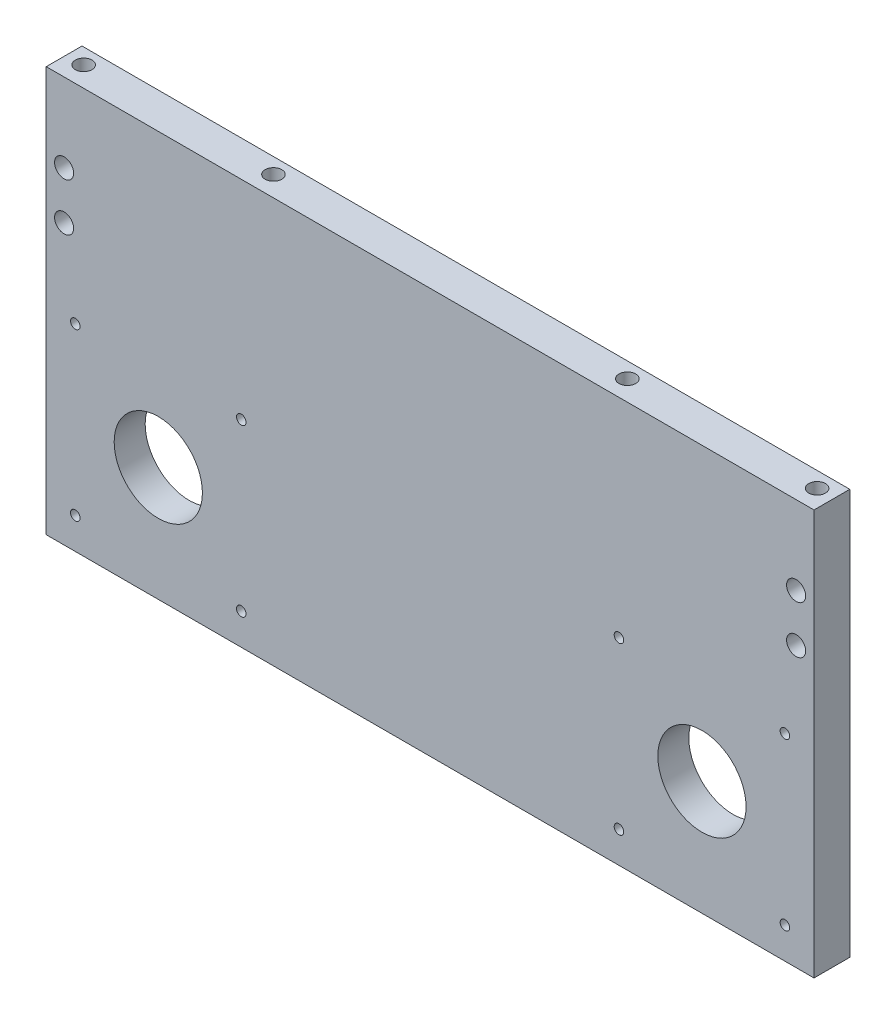
from build123d import *

# Parameters (mm, degrees)
SZKIC1_W                       = 322
SZKIC1_H                       = 170
DODANIE_WYCI_GNI_CIE1_DEPTH    = 15
SZKIC2_R                       = 2
WYTNIJ_WYCI_GNI_CIE2_DEPTH     = 17.75
SZYK_LINIOWY1_COUNT            = 2
SZYK_LINIOWY1_PITCH            = 69.6
SZYK_LINIOWY1_COUNT_DIR2       = 2
SZYK_LINIOWY1_PITCH_DIR2       = 69.6
SZKIC5_R                       = 37.5
WYTNIJ_WYCI_GNI_CIE3_DEPTH     = 2
SZKIC7_R                       = 18.5
WYTNIJ_WYCI_GNI_CIE4_DEPTH     = 17.75
SZYK_LINIOWY2_COUNT            = 2
SZYK_LINIOWY2_PITCH            = 228
SZYK_LINIOWY2_COPY_1_SKETCH_R  = 2
SZYK_LINIOWY2_COPY_1_DEPTH     = 17.75
SZYK_LINIOWY2_COPY_2_SKETCH_R  = 2
SZYK_LINIOWY2_COPY_2_DEPTH     = 17.75
SZYK_LINIOWY2_COPY_3_SKETCH_R  = 2
SZYK_LINIOWY2_COPY_3_DEPTH     = 17.75
SZKIC10_R                      = 4
WYTNIJ_WYCI_GNI_CIE7_DEPTH     = 183.677311125
SZKIC11_R                      = 4
WYTNIJ_WYCI_GNI_CIE8_DEPTH     = 183.677311125
OTW_R_GWINTOWANY_M8X1_01_D     = 7
OTW_R_GWINTOWANY_M8X1_01_DEPTH = 21
OTW_R_GWINTOWANY_M8X1_01_TIP   = 2.103012167


with BuildPart() as part:
    # Szkic1 → Dodanie-wyciągnięcie1 (new body)
    with BuildSketch(Plane.XY):
        Rectangle(SZKIC1_W, SZKIC1_H)
    extrude(amount=DODANIE_WYCI_GNI_CIE1_DEPTH)

    # Szkic2 → Wytnij-wyciągnięcie2 (cut)
    with BuildSketch(Plane.XY.offset(15)):
        with Locations((-148.8, -71.87)):
            Circle(SZKIC2_R)
    wytnij_wyci_gni_cie2 = extrude(amount=-WYTNIJ_WYCI_GNI_CIE2_DEPTH, mode=Mode.SUBTRACT)

    # Szyk liniowy1: Wytnij-wyci_gni_cie2 2 × 2
    with Locations(*[(i * SZYK_LINIOWY1_PITCH, j * SZYK_LINIOWY1_PITCH_DIR2, 0) for i in range(SZYK_LINIOWY1_COUNT) for j in range(SZYK_LINIOWY1_COUNT_DIR2) if (i, j) != (0, 0)]):
        add(wytnij_wyci_gni_cie2, mode=Mode.SUBTRACT)

    # Szkic5 → Wytnij-wyciągnięcie3 (cut)
    with BuildSketch(Plane(origin=(0, 0, 0), x_dir=(-1, 0, 0), z_dir=(0, 0, -1))):
        with Locations((114, -37.07)):
            Circle(SZKIC5_R)
    wytnij_wyci_gni_cie3 = extrude(amount=-WYTNIJ_WYCI_GNI_CIE3_DEPTH, mode=Mode.SUBTRACT)

    # Szkic7 → Wytnij-wyciągnięcie4 (cut)
    with BuildSketch(Plane(origin=(0, 0, 2), x_dir=(-1, 0, 0), z_dir=(0, 0, -1))):
        with Locations((114, -37.07)):
            Circle(SZKIC7_R)
    wytnij_wyci_gni_cie4 = extrude(amount=-WYTNIJ_WYCI_GNI_CIE4_DEPTH, mode=Mode.SUBTRACT)

    # Szyk liniowy2: Wytnij-wyciągnięcie2, Wytnij-wyciągnięcie3, Wytnij-wyciągnięcie4 ×2
    with Locations(*[(i * SZYK_LINIOWY2_PITCH, 0, 0) for i in range(1, SZYK_LINIOWY2_COUNT)]):
        add(wytnij_wyci_gni_cie2, mode=Mode.SUBTRACT)
        add(wytnij_wyci_gni_cie3, mode=Mode.SUBTRACT)
        add(wytnij_wyci_gni_cie4, mode=Mode.SUBTRACT)

    # Szyk liniowy2 copy 1 sketch → Szyk liniowy2 copy 1 (cut)
    with BuildSketch(Plane(origin=(228, 69.6, 15), x_dir=(1, 0, 0), z_dir=(0, 0, 1))):
        with Locations((-148.8, -71.87)):
            Circle(SZYK_LINIOWY2_COPY_1_SKETCH_R)
    extrude(amount=-SZYK_LINIOWY2_COPY_1_DEPTH, mode=Mode.SUBTRACT)

    # Szyk liniowy2 copy 2 sketch → Szyk liniowy2 copy 2 (cut)
    with BuildSketch(Plane(origin=(297.6, 0, 15), x_dir=(1, 0, 0), z_dir=(0, 0, 1))):
        with Locations((-148.8, -71.87)):
            Circle(SZYK_LINIOWY2_COPY_2_SKETCH_R)
    extrude(amount=-SZYK_LINIOWY2_COPY_2_DEPTH, mode=Mode.SUBTRACT)

    # Szyk liniowy2 copy 3 sketch → Szyk liniowy2 copy 3 (cut)
    with BuildSketch(Plane(origin=(297.6, 69.6, 15), x_dir=(1, 0, 0), z_dir=(0, 0, 1))):
        with Locations((-148.8, -71.87)):
            Circle(SZYK_LINIOWY2_COPY_3_SKETCH_R)
    extrude(amount=-SZYK_LINIOWY2_COPY_3_DEPTH, mode=Mode.SUBTRACT)

    # Szkic10 → Wytnij-wyciągnięcie7 (cut, through all)
    with BuildSketch(Plane.XY.offset(15)):
        with Locations((-153.5, 52)):
            Circle(SZKIC10_R)
        with Locations((-153.5, 32)):
            Circle(SZKIC10_R)
    extrude(amount=-WYTNIJ_WYCI_GNI_CIE7_DEPTH, mode=Mode.SUBTRACT)

    # Szkic11 → Wytnij-wyciągnięcie8 (cut, through all)
    with BuildSketch(Plane.XY.offset(15)):
        with Locations((153.5, 32)):
            Circle(SZKIC11_R)
        with Locations((153.5, 52)):
            Circle(SZKIC11_R)
    extrude(amount=-WYTNIJ_WYCI_GNI_CIE8_DEPTH, mode=Mode.SUBTRACT)

    # Otwór gwintowany M8x1.01
    with Locations(Plane(origin=(0, 85, 0), x_dir=(1, 0, 0), z_dir=(0, 1, 0))):
        with Locations((-153.8, -6.5), (-74.2, -6.5), (74.2, -6.5), (153.8, -6.5)):
            Hole(OTW_R_GWINTOWANY_M8X1_01_D / 2, depth=OTW_R_GWINTOWANY_M8X1_01_DEPTH)
            with Locations((0, 0, -(OTW_R_GWINTOWANY_M8X1_01_DEPTH + OTW_R_GWINTOWANY_M8X1_01_TIP / 2))):  # 118° drill point
                Cone(0, OTW_R_GWINTOWANY_M8X1_01_D / 2, OTW_R_GWINTOWANY_M8X1_01_TIP, mode=Mode.SUBTRACT)


solid = part.part
